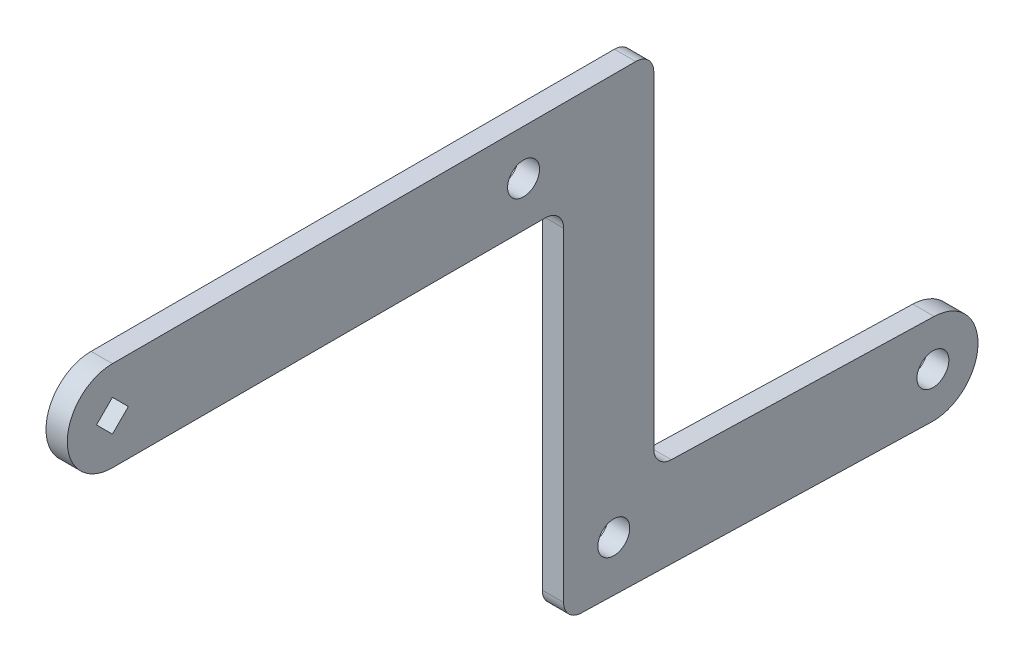
from build123d import *

# Parameters (mm, degrees)
SKETCH1_R               = 2.24506403
BOSS_EXTRUDE1_DEPTH     = 3
FILLET1_R               = 2.54
SKETCH2_R               = 2.2479
TORQUE_PREVENTION_DEPTH = 136.15202741


with BuildPart() as part:
    # Sketch1 → Boss-Extrude1 (new body)
    with BuildSketch(Plane(origin=(0, 0, 0), x_dir=(0, 0, -1), z_dir=(1, 0, 0))):
        with BuildLine():
            Line((0, -6.35), (63.5, -6.35))
            Line((63.5, -6.35), (63.5, -56.975747359))
            Line((63.5, -56.975747359), (115.31002724, -58.417542627))
            ThreePointArc((115.31002724, -58.417542627), (121.834212447, -52.246642581), (115.663312401, -45.722457373))
            Line((115.663312401, -45.722457373), (76.2, -44.624252641))
            Line((76.2, -44.624252641), (76.2, 6.35))
            Line((76.2, 6.35), (0, 6.35))
            ThreePointArc((0, 6.35), (-6.35, 0), (0, -6.35))
        make_face()
        with Locations((115.486669821, -52.07)):
            Circle(SKETCH1_R, mode=Mode.SUBTRACT)
        Polygon((0, 2.24506403), (2.24506403, 0), (0, -2.24506403), (-2.24506403, 0), align=None, mode=Mode.SUBTRACT)
    extrude(amount=BOSS_EXTRUDE1_DEPTH)

    # Fillet1
    fillet1_edges = [part.edges().sort_by_distance(p)[0] for p in [
        (1.5, -44.624252641, -76.2),
        (1.5, 6.35, -76.2),
        (1.5, -56.975747359, -63.5),
        (1.5, -6.35, -63.5),
    ]]
    fillet(fillet1_edges, radius=FILLET1_R)

    # Sketch2 → Torque prevention (cut, through all)
    with BuildSketch(Plane(origin=(3, 0, 0), x_dir=(0, 0, -1), z_dir=(1, 0, 0))):
        with Locations((70.569139096, -50.100595059)):
            Circle(SKETCH2_R)
        with Locations((57.869139096, 0)):
            Circle(SKETCH2_R)
    extrude(amount=-TORQUE_PREVENTION_DEPTH, mode=Mode.SUBTRACT)


solid = part.part
